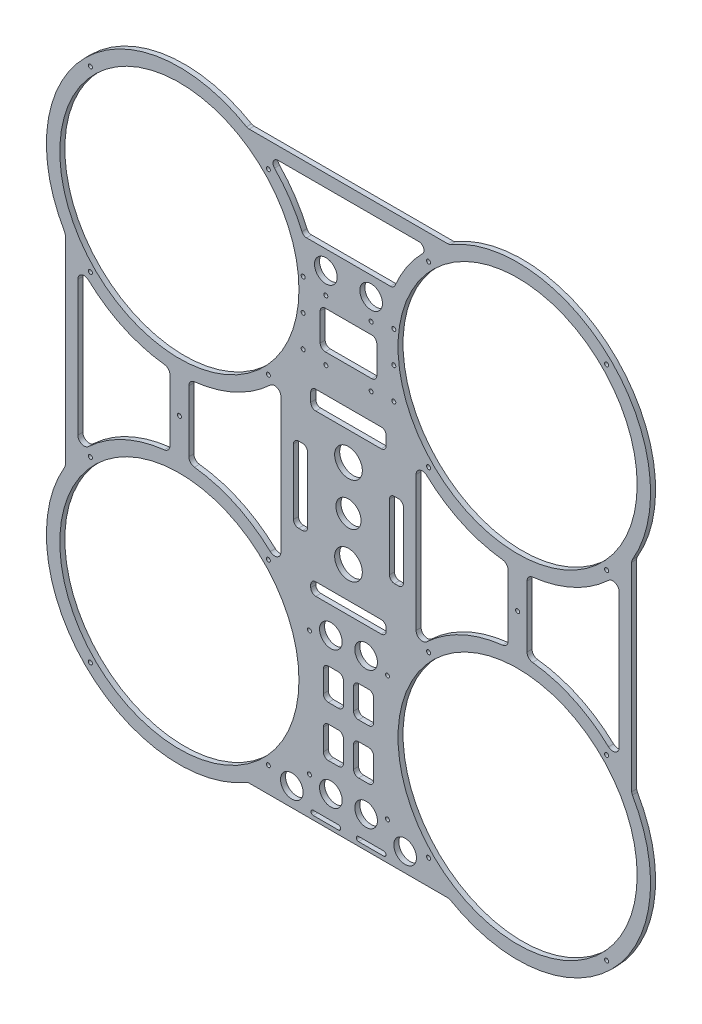
from build123d import *
from build123d.topology import SkipClean

# Parameters (mm, degrees)
SKETCH_1_W           = 310
SKETCH_1_H           = 310
EXTRUDE_1_DEPTH      = 4
SKETCH_2_R           = 5
SKETCH_2_R_2         = 1.6
CUT_EXTRUDE_2_DEPTH  = 4
SKETCH_3_R           = 2.5
CUT_EXTRUDE_3_DEPTH  = 4
SKETCH_4_R           = 10
CUT_EXTRUDE_4_DEPTH  = 10
EXTRUDE_2_DEPTH      = 4
EXTRUDE_3_DEPTH      = 4
CUT_EXTRUDE_12_DEPTH = 6
EXTRUDE_4_DEPTH      = 4
SKETCH_19_R          = 1.6
CUT_EXTRUDE_13_DEPTH = 6
SKETCH_20_R          = 95
CUT_EXTRUDE_14_DEPTH = 10
SKETCH_22_R          = 1.6
CUT_EXTRUDE_16_DEPTH = 10
CUT_EXTRUDE_17_DEPTH = 10
FILLET_1_R           = 5
CUT_EXTRUDE_18_DEPTH = 10
SKETCH_25_R          = 9
SKETCH_25_W          = 11.200576851
SKETCH_25_H          = 60
SKETCH_25_W_2        = 40
SKETCH_25_H_2        = 25
SKETCH_25_W_3        = 60
SKETCH_25_H_3        = 10
SKETCH_25_H_4        = 15
CUT_EXTRUDE_19_DEPTH = 10
FILLET_2_R           = 4
SKETCH_27_R          = 1.6
CUT_EXTRUDE_21_DEPTH = 10
CUT_EXTRUDE_22_DEPTH = 10
SKETCH_29_R          = 1.6
CUT_EXTRUDE_23_DEPTH = 90
SKETCH_26_R          = 1.6
CUT_EXTRUDE_20_DEPTH = 10
FILLET_3_R           = 4
SKETCH_30_W          = 8
SKETCH_30_H          = 65
EXTRUDE_5_DEPTH      = 4
FILLET_4_R           = 4
SKETCH_31_R          = 9
SKETCH_31_R_2        = 11
SKETCH_31_W          = 45
SKETCH_31_H          = 30
CUT_EXTRUDE_24_DEPTH = 4
FILLET_5_R           = 4
FILLET_7_R           = 4


with BuildPart() as part:
    # 草图1 → 凸台-拉伸1 (new body)
    with BuildSketch(Plane.XY):
        Rectangle(SKETCH_1_W, SKETCH_1_H)
    extrude(amount=EXTRUDE_1_DEPTH)

    # 草图2 → 切除-拉伸2 (cut)
    with BuildSketch(Plane.XY.offset(4)):
        with Locations((-134.350288425, -134.350288425)):
            Circle(SKETCH_2_R)
        with Locations((-134.350288425, -143.850288425)):
            Circle(SKETCH_2_R_2)
        with Locations((-143.850288425, -134.350288425)):
            Circle(SKETCH_2_R_2)
        with Locations((-134.350288425, -124.850288425)):
            Circle(SKETCH_2_R_2)
        with Locations((-124.850288425, -134.350288425)):
            Circle(SKETCH_2_R_2)
        with Locations((124.850288425, -134.350288425)):
            Circle(SKETCH_2_R_2)
        with Locations((134.350288425, -124.850288425)):
            Circle(SKETCH_2_R_2)
        with Locations((143.850288425, -134.350288425)):
            Circle(SKETCH_2_R_2)
        with Locations((134.350288425, -143.850288425)):
            Circle(SKETCH_2_R_2)
        with Locations((134.350288425, -134.350288425)):
            Circle(SKETCH_2_R)
        with Locations((134.350288425, 134.350288425)):
            Circle(SKETCH_2_R)
        with Locations((134.350288425, 143.850288425)):
            Circle(SKETCH_2_R_2)
        with Locations((143.850288425, 134.350288425)):
            Circle(SKETCH_2_R_2)
        with Locations((134.350288425, 124.850288425)):
            Circle(SKETCH_2_R_2)
        with Locations((124.850288425, 134.350288425)):
            Circle(SKETCH_2_R_2)
        with Locations((-124.850288425, 134.350288425)):
            Circle(SKETCH_2_R_2)
        with Locations((-134.350288425, 124.850288425)):
            Circle(SKETCH_2_R_2)
        with Locations((-143.850288425, 134.350288425)):
            Circle(SKETCH_2_R_2)
        with Locations((-134.350288425, 143.850288425)):
            Circle(SKETCH_2_R_2)
        with Locations((-134.350288425, 134.350288425)):
            Circle(SKETCH_2_R)
    extrude(amount=-CUT_EXTRUDE_2_DEPTH, mode=Mode.SUBTRACT)

    # 草图3 → 切除-拉伸3 (cut)
    with BuildSketch(Plane.XY.offset(4)):
        Circle(SKETCH_3_R)
    extrude(amount=-CUT_EXTRUDE_3_DEPTH, mode=Mode.SUBTRACT)

    # 草图4 → 切除-拉伸4 (cut)
    with BuildSketch(Plane.XY.offset(4)):
        Circle(SKETCH_4_R)
    extrude(amount=-CUT_EXTRUDE_4_DEPTH, mode=Mode.SUBTRACT)

    # 草图10 → 凸台-拉伸2 (add)
    with BuildSketch(Plane.XY.offset(4)):
        with BuildLine():
            ThreePointArc((155, -41.621709164), (201.525432638, -201.525432638), (41.621709164, -155))
            Line((41.621709164, -155), (30.738267078, -155))
            ThreePointArc((30.738267078, -155), (209.05591591, -209.05591591), (155, -30.738267078))
            Line((155, -30.738267078), (155, -41.621709164))
        make_face()
        with BuildLine():
            ThreePointArc((-155, -30.738267078), (-209.05591591, -209.05591591), (-30.738267078, -155))
            Line((-30.738267078, -155), (-41.621709164, -155))
            ThreePointArc((-41.621709164, -155), (-201.525432638, -201.525432638), (-155, -41.621709164))
            Line((-155, -41.621709164), (-155, -30.738267078))
        make_face()
        with BuildLine():
            Line((155, 41.621709164), (155, 30.738267078))
            ThreePointArc((155, 30.738267078), (209.05591591, 209.05591591), (30.738267078, 155))
            Line((30.738267078, 155), (41.621709164, 155))
            ThreePointArc((41.621709164, 155), (201.525432638, 201.525432638), (155, 41.621709164))
        make_face()
        with BuildLine():
            ThreePointArc((-30.738267078, 155), (-209.05591591, 209.05591591), (-155, 30.738267078))
            Line((-155, 30.738267078), (-155, 41.621709164))
            ThreePointArc((-155, 41.621709164), (-201.525432638, 201.525432638), (-41.621709164, 155))
            Line((-41.621709164, 155), (-30.738267078, 155))
        make_face()
    extrude(amount=-EXTRUDE_2_DEPTH)

    # 草图11 → 凸台-拉伸3 (add)
    with BuildSketch(Plane.XY.offset(4)):
        with BuildLine():
            Line((-225, 80.087120924), (-225, -80.087120924))
            ThreePointArc((-225, -80.087120924), (-195.224895137, -48.001323096), (-155, -30.738267078))
            Line((-155, -30.738267078), (-155, 30.738267078))
            ThreePointArc((-155, 30.738267078), (-195.224895137, 48.001323096), (-225, 80.087120924))
        make_face()
        with BuildLine():
            Line((30.738267078, -155), (-30.738267078, -155))
            ThreePointArc((-30.738267078, -155), (-48.001323096, -195.224895137), (-80.087120924, -225))
            Line((-80.087120924, -225), (80.087120924, -225))
            ThreePointArc((80.087120924, -225), (48.001323096, -195.224895137), (30.738267078, -155))
        make_face()
        with BuildLine():
            Line((225, -80.087120924), (225, 80.087120924))
            ThreePointArc((225, 80.087120924), (195.224895137, 48.001323096), (155, 30.738267078))
            Line((155, 30.738267078), (155, -30.738267078))
            ThreePointArc((155, -30.738267078), (195.224895137, -48.001323096), (225, -80.087120924))
        make_face()
        with BuildLine():
            Line((-30.738267078, 155), (30.738267078, 155))
            ThreePointArc((30.738267078, 155), (48.001323096, 195.224895137), (80.087120924, 225))
            Line((80.087120924, 225), (-80.087120924, 225))
            ThreePointArc((-80.087120924, 225), (-48.001323096, 195.224895137), (-30.738267078, 155))
        make_face()
    extrude(amount=-EXTRUDE_3_DEPTH)

    # 草图12 → 切除-拉伸12 (cut)
    with BuildSketch(Plane.XY.offset(4)):
        with BuildLine():
            Line((-74.619410158, -60.477274534), (-129.173907523, -115.0317719))
            ThreePointArc((-129.173907523, -115.0317719), (-148.492424049, -148.492424049), (-115.0317719, -129.173907523))
            Line((-115.0317719, -129.173907523), (-60.477274534, -74.619410158))
            ThreePointArc((-60.477274534, -74.619410158), (-201.525432638, -201.525432638), (-74.619410158, -60.477274534))
        make_face()
        with BuildLine():
            Line((74.619410158, -60.477274534), (129.173907523, -115.0317719))
            ThreePointArc((129.173907523, -115.0317719), (148.492424049, -148.492424049), (115.0317719, -129.173907523))
            Line((115.0317719, -129.173907523), (60.477274534, -74.619410158))
            ThreePointArc((60.477274534, -74.619410158), (201.525432638, -201.525432638), (74.619410158, -60.477274534))
        make_face()
        with BuildLine():
            Line((60.477274534, 74.619410158), (115.0317719, 129.173907523))
            ThreePointArc((115.0317719, 129.173907523), (148.492424049, 148.492424049), (129.173907523, 115.0317719))
            Line((129.173907523, 115.0317719), (74.619410158, 60.477274534))
            ThreePointArc((74.619410158, 60.477274534), (201.525432638, 201.525432638), (60.477274534, 74.619410158))
        make_face()
        with BuildLine():
            Line((-74.619410158, 60.477274534), (-129.173907523, 115.0317719))
            ThreePointArc((-129.173907523, 115.0317719), (-148.492424049, 148.492424049), (-115.0317719, 129.173907523))
            Line((-115.0317719, 129.173907523), (-60.477274534, 74.619410158))
            ThreePointArc((-60.477274534, 74.619410158), (-201.525432638, 201.525432638), (-74.619410158, 60.477274534))
        make_face()
    extrude(amount=-CUT_EXTRUDE_12_DEPTH, mode=Mode.SUBTRACT)

    # 草图15 → 凸台-拉伸4 (add)
    with BuildSketch(Plane.XY.offset(4)):
        with BuildLine():
            Line((194.081166693, -60.477274534), (139.526669327, -115.0317719))
            ThreePointArc((139.526669327, -115.0317719), (148.492424049, -120.208152802), (153.668804951, -129.173907523))
            Line((153.668804951, -129.173907523), (208.223302317, -74.619410158))
            ThreePointArc((208.223302317, -74.619410158), (201.525432638, -67.175144213), (194.081166693, -60.477274534))
        make_face()
        with BuildLine():
            Line((208.223302317, -194.081166693), (153.668804951, -139.526669327))
            ThreePointArc((153.668804951, -139.526669327), (148.492424049, -148.492424049), (139.526669327, -153.668804951))
            Line((139.526669327, -153.668804951), (194.081166693, -208.223302317))
            ThreePointArc((194.081166693, -208.223302317), (201.525432638, -201.525432638), (208.223302317, -194.081166693))
        make_face()
        with BuildLine():
            Line((74.619410158, -208.223302317), (129.173907523, -153.668804951))
            ThreePointArc((129.173907523, -153.668804951), (120.208152802, -148.492424049), (115.0317719, -139.526669327))
            Line((115.0317719, -139.526669327), (60.477274534, -194.081166693))
            ThreePointArc((60.477274534, -194.081166693), (67.175144213, -201.525432638), (74.619410158, -208.223302317))
        make_face()
        with BuildLine():
            Line((-60.477274534, -194.081166693), (-115.0317719, -139.526669327))
            ThreePointArc((-115.0317719, -139.526669327), (-120.208152802, -148.492424049), (-129.173907523, -153.668804951))
            Line((-129.173907523, -153.668804951), (-74.619410158, -208.223302317))
            ThreePointArc((-74.619410158, -208.223302317), (-67.175144213, -201.525432638), (-60.477274534, -194.081166693))
        make_face()
        with BuildLine():
            Line((-194.081166693, -208.223302317), (-139.526669327, -153.668804951))
            ThreePointArc((-139.526669327, -153.668804951), (-148.492424049, -148.492424049), (-153.668804951, -139.526669327))
            Line((-153.668804951, -139.526669327), (-208.223302317, -194.081166693))
            ThreePointArc((-208.223302317, -194.081166693), (-201.525432638, -201.525432638), (-194.081166693, -208.223302317))
        make_face()
        with BuildLine():
            Line((-208.223302317, -74.619410158), (-153.668804951, -129.173907523))
            ThreePointArc((-153.668804951, -129.173907523), (-148.492424049, -120.208152802), (-139.526669327, -115.0317719))
            Line((-139.526669327, -115.0317719), (-194.081166693, -60.477274534))
            ThreePointArc((-194.081166693, -60.477274534), (-201.525432638, -67.175144213), (-208.223302317, -74.619410158))
        make_face()
        with BuildLine():
            Line((-194.081166693, 60.477274534), (-139.526669327, 115.0317719))
            ThreePointArc((-139.526669327, 115.0317719), (-148.492424049, 120.208152802), (-153.668804951, 129.173907523))
            Line((-153.668804951, 129.173907523), (-208.223302317, 74.619410158))
            ThreePointArc((-208.223302317, 74.619410158), (-201.525432638, 67.175144213), (-194.081166693, 60.477274534))
        make_face()
        with BuildLine():
            Line((-208.223302317, 194.081166693), (-153.668804951, 139.526669327))
            ThreePointArc((-153.668804951, 139.526669327), (-148.492424049, 148.492424049), (-139.526669327, 153.668804951))
            Line((-139.526669327, 153.668804951), (-194.081166693, 208.223302317))
            ThreePointArc((-194.081166693, 208.223302317), (-201.525432638, 201.525432638), (-208.223302317, 194.081166693))
        make_face()
        with BuildLine():
            Line((-74.619410158, 208.223302317), (-129.173907523, 153.668804951))
            ThreePointArc((-129.173907523, 153.668804951), (-120.208152802, 148.492424049), (-115.0317719, 139.526669327))
            Line((-115.0317719, 139.526669327), (-60.477274534, 194.081166693))
            ThreePointArc((-60.477274534, 194.081166693), (-67.175144213, 201.525432638), (-74.619410158, 208.223302317))
        make_face()
        with BuildLine():
            Line((60.477274534, 194.081166693), (115.0317719, 139.526669327))
            ThreePointArc((115.0317719, 139.526669327), (120.208152802, 148.492424049), (129.173907523, 153.668804951))
            Line((129.173907523, 153.668804951), (74.619410158, 208.223302317))
            ThreePointArc((74.619410158, 208.223302317), (67.175144213, 201.525432638), (60.477274534, 194.081166693))
        make_face()
        with BuildLine():
            Line((194.081166693, 208.223302317), (139.526669327, 153.668804951))
            ThreePointArc((139.526669327, 153.668804951), (148.492424049, 148.492424049), (153.668804951, 139.526669327))
            Line((153.668804951, 139.526669327), (208.223302317, 194.081166693))
            ThreePointArc((208.223302317, 194.081166693), (201.525432638, 201.525432638), (194.081166693, 208.223302317))
        make_face()
        with BuildLine():
            Line((208.223302317, 74.619410158), (153.668804951, 129.173907523))
            ThreePointArc((153.668804951, 129.173907523), (148.492424049, 120.208152802), (139.526669327, 115.0317719))
            Line((139.526669327, 115.0317719), (194.081166693, 60.477274534))
            ThreePointArc((194.081166693, 60.477274534), (201.525432638, 67.175144213), (208.223302317, 74.619410158))
        make_face()
    extrude(amount=-EXTRUDE_4_DEPTH)

    # 草图19 → 切除-拉伸13 (cut)
    with BuildSketch(Plane.XY.offset(4)):
        with Locations((63.639610307, -63.639610307)):
            Circle(SKETCH_19_R)
        with Locations((205.060966544, -63.639610307)):
            Circle(SKETCH_19_R)
        with Locations((205.060966544, -205.060966544)):
            Circle(SKETCH_19_R)
        with Locations((63.639610307, -205.060966544)):
            Circle(SKETCH_19_R)
        with Locations((-63.639610307, -205.060966544)):
            Circle(SKETCH_19_R)
        with Locations((-205.060966544, -205.060966544)):
            Circle(SKETCH_19_R)
        with Locations((-205.060966544, -63.639610307)):
            Circle(SKETCH_19_R)
        with Locations((-63.639610307, -63.639610307)):
            Circle(SKETCH_19_R)
        with Locations((-63.639610307, 63.639610307)):
            Circle(SKETCH_19_R)
        with Locations((-205.060966544, 63.639610307)):
            Circle(SKETCH_19_R)
        with Locations((-205.060966544, 205.060966544)):
            Circle(SKETCH_19_R)
        with Locations((-63.639610307, 205.060966544)):
            Circle(SKETCH_19_R)
        with Locations((63.639610307, 205.060966544)):
            Circle(SKETCH_19_R)
        with Locations((205.060966544, 205.060966544)):
            Circle(SKETCH_19_R)
        with Locations((205.060966544, 63.639610307)):
            Circle(SKETCH_19_R)
        with Locations((63.639610307, 63.639610307)):
            Circle(SKETCH_19_R)
    extrude(amount=-CUT_EXTRUDE_13_DEPTH, mode=Mode.SUBTRACT)

    # 草图20 → 切除-拉伸14 (cut)
    with SkipClean():  # the faces are left unmerged after this step: merging them gives an invalid solid
        with BuildSketch(Plane.XY.offset(4)):
            with Locations((-134.350288425, -134.350288425)):
                Circle(SKETCH_20_R)
            with Locations((-134.350288425, 134.350288425)):
                Circle(SKETCH_20_R)
            with Locations((134.350288425, 134.350288425)):
                Circle(SKETCH_20_R)
            with Locations((134.350288425, -134.350288425)):
                Circle(SKETCH_20_R)
        extrude(amount=-CUT_EXTRUDE_14_DEPTH, mode=Mode.SUBTRACT)

    # 草图22 → 切除-拉伸16 (cut)
    with SkipClean():  # the faces are left unmerged after this step: merging them gives an invalid solid
        with BuildSketch(Plane.XY.offset(4)):
            with Locations((-31, -96)):
                Circle(SKETCH_22_R)
            with Locations((-31, -195)):
                Circle(SKETCH_22_R)
            with Locations((31, -195)):
                Circle(SKETCH_22_R)
            with Locations((31, -96)):
                Circle(SKETCH_22_R)
        extrude(amount=-CUT_EXTRUDE_16_DEPTH, mode=Mode.SUBTRACT)

    # 草图23 → 切除-拉伸17 (cut)
    with SkipClean():  # the faces are left unmerged after this step: merging them gives an invalid solid
        with BuildSketch(Plane.XY.offset(4)):
            with BuildLine():
                Line((-215, 66.104515086), (-215, -66.104515086))
                ThreePointArc((-215, -66.104515086), (-182.176948203, -40.145871489), (-141.850288425, -28.967122997))
                Line((-141.850288425, -28.967122997), (-141.850288425, 28.967122997))
                ThreePointArc((-141.850288425, 28.967122997), (-182.176948203, 40.145871489), (-215, 66.104515086))
            make_face()
            with BuildLine():
                Line((-126.850288425, 28.967122997), (-126.850288425, -28.967122997))
                ThreePointArc((-126.850288425, -28.967122997), (-86.523628648, -40.145871489), (-53.700576851, -66.104515086))
                Line((-53.700576851, -66.104515086), (-53.700576851, 66.104515086))
                ThreePointArc((-53.700576851, 66.104515086), (-86.523628648, 40.145871489), (-126.850288425, 28.967122997))
            make_face()
            with BuildLine():
                Line((53.700576851, 66.104515086), (53.700576851, -66.104515086))
                ThreePointArc((53.700576851, -66.104515086), (86.523628648, -40.145871489), (126.850288425, -28.967122997))
                Line((126.850288425, -28.967122997), (126.850288425, 28.967122997))
                ThreePointArc((126.850288425, 28.967122997), (86.523628648, 40.145871489), (53.700576851, 66.104515086))
            make_face()
            with BuildLine():
                Line((141.850288425, 28.967122997), (141.850288425, -28.967122997))
                ThreePointArc((141.850288425, -28.967122997), (182.176948203, -40.145871489), (215, -66.104515086))
                Line((215, -66.104515086), (215, 66.104515086))
                ThreePointArc((215, 66.104515086), (182.176948203, 40.145871489), (141.850288425, 28.967122997))
            make_face()
        extrude(amount=-CUT_EXTRUDE_17_DEPTH, mode=Mode.SUBTRACT)

    # 圆角1
    fillet_1_edges = [part.edges().sort_by_distance(p)[0] for p in [
        (141.850288425, 28.967122997, 2),
        (215, 66.104515086, 2),
        (215, -66.104515086, 2),
        (141.850288425, -28.967122997, 2),
        (126.850288425, -28.967122997, 2),
        (53.700576851, -66.104515086, 2),
        (53.700576851, 66.104515086, 2),
        (126.850288425, 28.967122997, 2),
        (-53.700576851, -66.104515086, 2),
        (-126.850288425, -28.967122997, 2),
        (-126.850288425, 28.967122997, 2),
        (-53.700576851, 66.104515086, 2),
        (-141.850288425, -28.967122997, 2),
        (-215, -66.104515086, 2),
        (-141.850288425, 28.967122997, 2),
        (-215, 66.104515086, 2),
    ]]
    fillet(fillet_1_edges, radius=FILLET_1_R)

    # 草图24 → 切除-拉伸18 (cut)
    with SkipClean():  # the faces are left unmerged after this step: merging them gives an invalid solid
        with BuildSketch(Plane.XY.offset(4)):
            with BuildLine():
                Line((-28, -218.2), (-8, -218.2))
                ThreePointArc((-8, -218.2), (-6.2, -220), (-8, -221.8))
                Line((-8, -221.8), (-28, -221.8))
                ThreePointArc((-28, -221.8), (-29.8, -220), (-28, -218.2))
            make_face()
            with BuildLine():
                Line((28, -218.2), (8, -218.2))
                ThreePointArc((8, -218.2), (6.2, -220), (8, -221.8))
                Line((8, -221.8), (28, -221.8))
                ThreePointArc((28, -221.8), (29.8, -220), (28, -218.2))
            make_face()
        extrude(amount=-CUT_EXTRUDE_18_DEPTH, mode=Mode.SUBTRACT)

    # 草图25 → 切除-拉伸19 (cut)
    with SkipClean():  # the faces are left unmerged after this step: merging them gives an invalid solid
        with BuildSketch(Plane.XY.offset(4)):
            with Locations((-14, -200)):
                Circle(SKETCH_25_R)
            with Locations((14, -200)):
                Circle(SKETCH_25_R)
            with Locations((-45, -210)):
                Circle(SKETCH_25_R)
            with Locations((45, -210)):
                Circle(SKETCH_25_R)
            with Locations((14, -91)):
                Circle(SKETCH_25_R)
            with Locations((-14, -91)):
                Circle(SKETCH_25_R)
            with Locations((-38.100288425, 0)):
                Rectangle(SKETCH_25_W, SKETCH_25_H)
            with Locations((38.100288425, 0)):
                Rectangle(SKETCH_25_W, SKETCH_25_H)
            with Locations((0, -165.5)):
                Rectangle(SKETCH_25_W_2, SKETCH_25_H_2)
            with Locations((0, -125.5)):
                Rectangle(SKETCH_25_W_2, SKETCH_25_H_2)
            with Locations((0, -65)):
                Rectangle(SKETCH_25_W_3, SKETCH_25_H_3)
            with Locations((0, 65)):
                Rectangle(SKETCH_25_W_3, SKETCH_25_H_4)
        extrude(amount=-CUT_EXTRUDE_19_DEPTH, mode=Mode.SUBTRACT)

    # 圆角2
    fillet_2_edges = [part.edges().sort_by_distance(p)[0] for p in [
        (-32.5, 30, 2),
        (-32.5, -30, 2),
        (-43.700576851, -30, 2),
        (-43.700576851, 30, 2),
        (20, -113, 2),
        (20, -138, 2),
        (-20, -138, 2),
        (-20, -113, 2),
        (-20, -178, 2),
        (-20, -153, 2),
        (20, -153, 2),
        (20, -178, 2),
        (32.5, -30, 2),
        (32.5, 30, 2),
        (43.700576851, 30, 2),
        (43.700576851, -30, 2),
        (-30, -70, 2),
        (30, -60, 2),
        (30, -70, 2),
        (-30, -60, 2),
    ]]
    fillet(fillet_2_edges, radius=FILLET_2_R)

    # 草图27 → 切除-拉伸21 (cut)
    with SkipClean():  # the faces are left unmerged after this step: merging them gives an invalid solid
        with BuildSketch(Plane.XY.offset(4)):
            with Locations((-36, 205)):
                Circle(SKETCH_27_R)
            with Locations((-36, 145)):
                Circle(SKETCH_27_R)
            with Locations((36, 145)):
                Circle(SKETCH_27_R)
            with Locations((36, 205)):
                Circle(SKETCH_27_R)
            with Locations((-36, 95)):
                Circle(SKETCH_27_R)
            with Locations((36, 95)):
                Circle(SKETCH_27_R)
            with Locations((-36, 120)):
                Circle(SKETCH_27_R)
            with Locations((36, 120)):
                Circle(SKETCH_27_R)
        extrude(amount=-CUT_EXTRUDE_21_DEPTH, mode=Mode.SUBTRACT)

    # 草图28 → 切除-拉伸22 (cut)
    with SkipClean():  # the faces are left unmerged after this step: merging them gives an invalid solid
        with BuildSketch(Plane.XY.offset(4)):
            with BuildLine():
                Line((-36.023988022, 173), (36.023988022, 173))
                ThreePointArc((36.023988022, 173), (48.457541713, 195.866933474), (66.104515086, 215))
                Line((66.104515086, 215), (-66.104515086, 215))
                ThreePointArc((-66.104515086, 215), (-48.457541713, 195.866933474), (-36.023988022, 173))
            make_face()
        extrude(amount=-CUT_EXTRUDE_22_DEPTH, mode=Mode.SUBTRACT)

    # 草图29 → 切除-拉伸23 (cut)
    with SkipClean():  # the faces are left unmerged after this step: merging them gives an invalid solid
        with BuildSketch(Plane.XY.offset(4)):
            with Locations((-18, 141)):
                Circle(SKETCH_29_R)
            with Locations((-18, 93)):
                Circle(SKETCH_29_R)
            with Locations((18, 141)):
                Circle(SKETCH_29_R)
            with Locations((18, 93)):
                Circle(SKETCH_29_R)
        extrude(amount=-CUT_EXTRUDE_23_DEPTH, mode=Mode.SUBTRACT)

    # 草图26 → 切除-拉伸20 (cut)
    with SkipClean():  # the faces are left unmerged after this step: merging them gives an invalid solid
        with BuildSketch(Plane.XY.offset(4)):
            with Locations((-134.350288425, 0)):
                Circle(SKETCH_26_R)
            with Locations((134.350288425, 0)):
                Circle(SKETCH_26_R)
        extrude(amount=-CUT_EXTRUDE_20_DEPTH, mode=Mode.SUBTRACT)

    # 圆角3
    fillet_3_edges = [part.edges().sort_by_distance(p)[0] for p in [
        (-30, 57.5, 2),
        (30, 72.5, 2),
        (30, 57.5, 2),
        (-225, 80.087120924, 2),
        (-225, -80.087120924, 2),
        (-80.087120924, -225, 2),
        (80.087120924, -225, 2),
        (225, -80.087120924, 2),
        (225, 80.087120924, 2),
        (36.023988022, 173, 2),
        (-36.023988022, 173, 2),
        (-30, 72.5, 2),
    ]]
    fillet(fillet_3_edges, radius=FILLET_3_R)

    # 草图30 → 凸台-拉伸5 (add)
    with SkipClean():  # the faces are left unmerged after this step: merging them gives an invalid solid
        with BuildSketch(Plane.XY.offset(4)):
            with Locations((0, -145.5)):
                Rectangle(SKETCH_30_W, SKETCH_30_H)
        extrude(amount=-EXTRUDE_5_DEPTH)

    # 圆角4
    fillet_4_edges = [part.edges().sort_by_distance(p)[0] for p in [
        (4, -178, 2),
        (4, -153, 2),
        (-4, -138, 2),
        (-4, -178, 2),
        (-4, -153, 2),
        (4, -113, 2),
        (4, -138, 2),
        (-4, -113, 2),
    ]]
    fillet(fillet_4_edges, radius=FILLET_4_R)

    # 草图31 → 切除-拉伸24 (cut)
    with SkipClean():  # the faces are left unmerged after this step: merging them gives an invalid solid
        with BuildSketch(Plane.XY.offset(4)):
            with Locations((-18, 158)):
                Circle(SKETCH_31_R)
            with Locations((18, 158)):
                Circle(SKETCH_31_R)
            with Locations((0, -35)):
                Circle(SKETCH_31_R_2)
            with Locations((0, 35)):
                Circle(SKETCH_31_R_2)
            with Locations((0, 117)):
                Rectangle(SKETCH_31_W, SKETCH_31_H)
        extrude(amount=-CUT_EXTRUDE_24_DEPTH, mode=Mode.SUBTRACT)

    # 圆角5
    fillet_5_edges = [part.edges().sort_by_distance(p)[0] for p in [
        (-22.5, 102, 2),
        (22.5, 132, 2),
        (22.5, 102, 2),
        (-22.5, 132, 2),
    ]]
    fillet(fillet_5_edges, radius=FILLET_5_R)

    # 圆角7
    fillet_7_edges = [part.edges().sort_by_distance(p)[0] for p in [
        (80.087120924, 225, 2),
        (-80.087120924, 225, 2),
        (66.104515086, 215, 2),
        (-66.104515086, 215, 2),
    ]]
    fillet(fillet_7_edges, radius=FILLET_7_R)


solid = part.part
